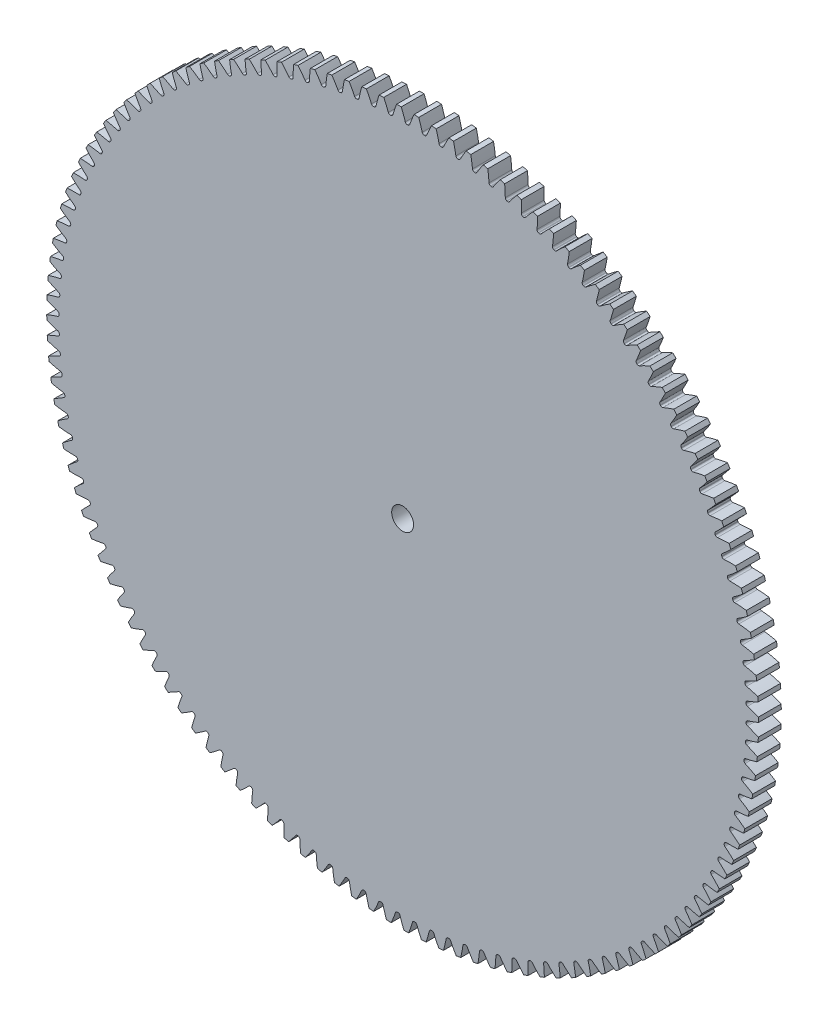
from build123d import *

# Parameters (mm, degrees)
SKETCH3_R         = 51.59375
GEARBODY_DEPTH    = 3.301999879
TOOTHCUT_DEPTH    = 74.039258494
CIRPATTERN1_COUNT = 128
BOREDIA_R         = 1.5875
BORE_DEPTH        = 12700


with BuildPart() as part:
    # Sketch3 → gearBody (new body)
    with BuildSketch(Plane.XY):
        Circle(SKETCH3_R)
    extrude(amount=GEARBODY_DEPTH)

    # Sketch2 → toothCut (cut, through all)
    with BuildSketch(Plane.XY):
        with BuildLine():
            ThreePointArc((49.791128573, -0.744880041), (49.791669175, -0.707821777), (49.792182195, -0.670763122))
            ThreePointArc((49.792182195, -0.670763122), (49.85206095, -0.493754461), (50.00423691, -0.385310888))
            ThreePointArc((50.00423691, -0.385310888), (55.775785838, 2.567286461), (60.26561802, 7.243825258))
            ThreePointArc((60.26561802, 7.243825258), (60.693272312, -0.862795335), (60.035355364, -8.953983809))
            ThreePointArc((60.035355364, -8.953983809), (55.680270843, -4.151708623), (49.994983452, -1.036244707))
            ThreePointArc((49.994983452, -1.036244707), (49.845951557, -0.923519263), (49.791128573, -0.744880041))
        make_face()
    toothcut = extrude(amount=TOOTHCUT_DEPTH, mode=Mode.SUBTRACT)

    # CirPattern1: toothCut ×128 about axis
    cirpattern1_axis = Axis((0, 0, 0), (0, 0, 1))
    for i in range(1, CIRPATTERN1_COUNT):
        add(toothcut.rotate(cirpattern1_axis, i * 360 / CIRPATTERN1_COUNT), mode=Mode.SUBTRACT)

    # boreDia → bore (cut, symmetric)
    with BuildSketch(Plane.XY):
        Circle(BOREDIA_R)
    extrude(amount=BORE_DEPTH, both=True, mode=Mode.SUBTRACT)


solid = part.part
